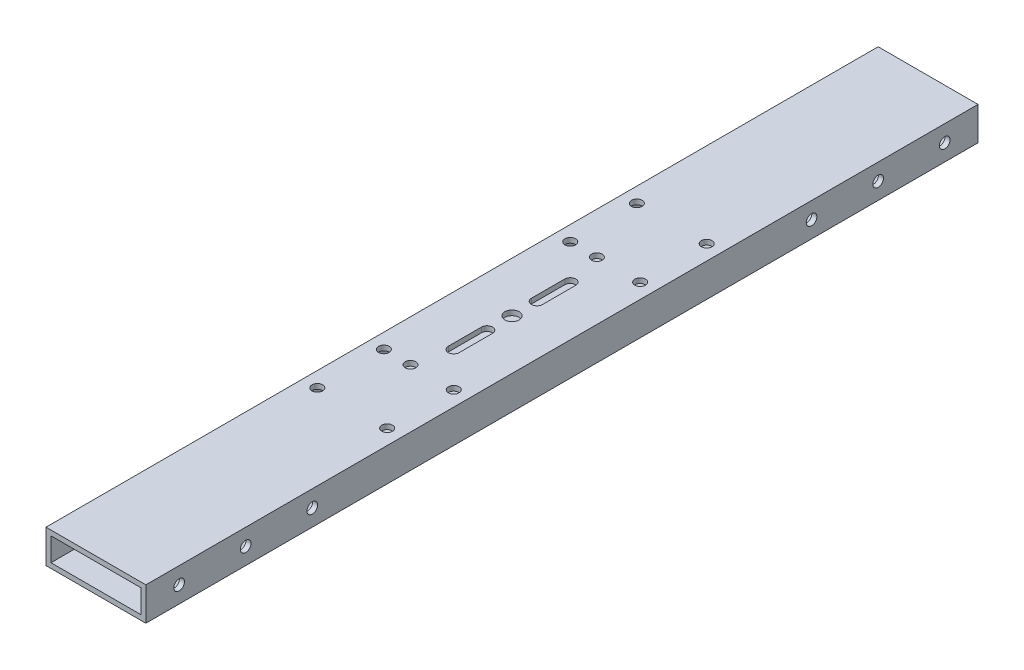
from build123d import *

# Parameters (mm, degrees)
SKETCH_1_W          = 30
SKETCH_1_H          = 10
SKETCH_1_W_2        = 27
SKETCH_1_H_2        = 7
EXTRUDE_1_DEPTH     = 250
SKETCH_2_R          = 1.6
CUT_EXTRUDE_1_DEPTH = 252.843205189
SKETCH_3_R          = 1.6
CUT_EXTRUDE_2_DEPTH = 251.64915719
SKETCH_4_R          = 2.15
CUT_EXTRUDE_3_DEPTH = 251.64915719


with BuildPart() as part:
    # 草图1 → 凸台-拉伸1 (new body)
    with BuildSketch(Plane.XY):
        Rectangle(SKETCH_1_W, SKETCH_1_H)
        Rectangle(SKETCH_1_W_2, SKETCH_1_H_2, mode=Mode.SUBTRACT)
    extrude(amount=EXTRUDE_1_DEPTH)

    # 草图2 → 切除-拉伸1 (cut, through all)
    with BuildSketch(Plane(origin=(15, 0, 0), x_dir=(0, 0, -1), z_dir=(1, 0, 0))):
        with Locations((-240, 0)):
            Circle(SKETCH_2_R)
        with Locations((-220, 0)):
            Circle(SKETCH_2_R)
        with Locations((-200, 0)):
            Circle(SKETCH_2_R)
        with Locations((-50, 0)):
            Circle(SKETCH_2_R)
        with Locations((-30, 0)):
            Circle(SKETCH_2_R)
        with Locations((-10, 0)):
            Circle(SKETCH_2_R)
    extrude(amount=-CUT_EXTRUDE_1_DEPTH, mode=Mode.SUBTRACT)

    # 草图3 → 切除-拉伸2 (cut, through all)
    with BuildSketch(Plane(origin=(0, 5, 0), x_dir=(1, 0, 0), z_dir=(0, 1, 0))):
        with Locations((-2.5, -97)):
            Circle(SKETCH_3_R)
        with Locations((10.5, -97)):
            Circle(SKETCH_3_R)
        with Locations((-2.5, -153)):
            Circle(SKETCH_3_R)
        with Locations((10.5, -153)):
            Circle(SKETCH_3_R)
        with Locations((10.5, -173)):
            Circle(SKETCH_3_R)
        with Locations((10.5, -77)):
            Circle(SKETCH_3_R)
        with Locations((-10.5, -173)):
            Circle(SKETCH_3_R)
        with Locations((-10.5, -153)):
            Circle(SKETCH_3_R)
        with Locations((-10.5, -77)):
            Circle(SKETCH_3_R)
        with Locations((-10.5, -97)):
            Circle(SKETCH_3_R)
    extrude(amount=-CUT_EXTRUDE_2_DEPTH, mode=Mode.SUBTRACT)

    # 草图4 → 切除-拉伸3 (cut, through all)
    with BuildSketch(Plane(origin=(0, 5, 0), x_dir=(1, 0, 0), z_dir=(0, 1, 0))):
        with Locations((0, -125)):
            Circle(SKETCH_4_R)
        with BuildLine():
            Line((-1.65, -107.5), (-1.65, -117.5))
            ThreePointArc((-1.65, -117.5), (0, -119.15), (1.65, -117.5))
            Line((1.65, -117.5), (1.65, -107.5))
            ThreePointArc((1.65, -107.5), (0, -105.85), (-1.65, -107.5))
        make_face()
        with BuildLine():
            Line((1.65, -142.5), (1.65, -132.5))
            ThreePointArc((1.65, -132.5), (0, -130.85), (-1.65, -132.5))
            Line((-1.65, -132.5), (-1.65, -142.5))
            ThreePointArc((-1.65, -142.5), (0, -144.15), (1.65, -142.5))
        make_face()
    extrude(amount=-CUT_EXTRUDE_3_DEPTH, mode=Mode.SUBTRACT)


solid = part.part
